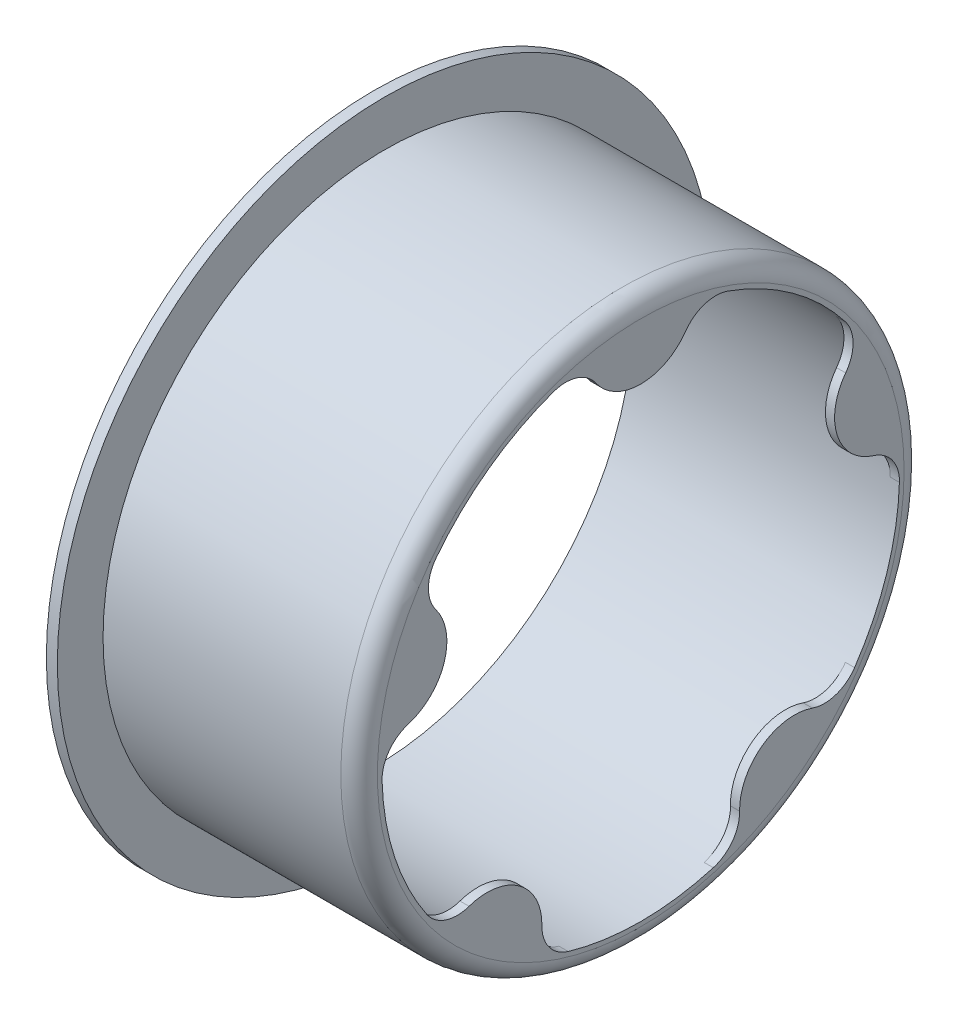
from build123d import *

# Parameters (mm, degrees)
SKETCH_3_R          = 19
CUT_EXTRUDE_1_DEPTH = 0.6
EXTRUDE_1_DEPTH     = 0.5
FILLET_1_R          = 2
FILLET_2_R          = 1


with BuildPart() as part:
    # 草图2 → 旋转1 (revolve)
    with BuildSketch(Plane(origin=(0, 0, 0), x_dir=(1, 0, 0), z_dir=(0, 1, 0)), mode=Mode.PRIVATE) as revolve_1_sk:
        Polygon((-7.6, 14.15), (-7.6, 17.9), (-7, 17.9), (-7, 15.4), (7, 15.4), (7, 17.9), (7.6, 17.9), (7.6, 14.15), align=None)
    revolve(revolve_1_sk.sketch.rotate(Axis((-68.553057404, 0, 0), (1, 0, 0)), 180), axis=Axis((-68.553057404, 0, 0), (1, 0, 0)))

    # 草图3 → 切除-拉伸1 (cut)
    with BuildSketch(Plane(origin=(7.6, 0, 0), x_dir=(0, 0, -1), z_dir=(1, 0, 0))):
        Circle(SKETCH_3_R)
    extrude(amount=-CUT_EXTRUDE_1_DEPTH, mode=Mode.SUBTRACT)

    # 草图4 → 凸台-拉伸1 (add)
    with BuildSketch(Plane(origin=(7, 0, 0), x_dir=(0, 0, -1), z_dir=(1, 0, 0))):
        with BuildLine():
            ThreePointArc((-12.378887951, 7.159129353), (-13.600108183, 4.41894302), (-14.222761377, 1.484270465))
            ThreePointArc((-14.222761377, 1.484270465), (-10.746938634, 3.491892036), (-12.378887951, 7.159129353))
        make_face()
        with BuildLine():
            ThreePointArc((-2.983449874, 13.985314685), (0, 11.3), (2.983449874, 13.985314685))
            ThreePointArc((2.983449874, 13.985314685), (0, 14.3), (-2.983449874, 13.985314685))
        make_face()
        with BuildLine():
            ThreePointArc((12.378887951, 7.159129353), (10.746938634, 3.491892036), (14.222761377, 1.484270465))
            ThreePointArc((14.222761377, 1.484270465), (13.600108183, 4.41894302), (12.378887951, 7.159129353))
        make_face()
        with BuildLine():
            ThreePointArc((10.634023371, -9.560729415), (6.641973351, -9.141892036), (5.80670007, -13.067985089))
            ThreePointArc((5.80670007, -13.067985089), (8.405329108, -11.56894302), (10.634023371, -9.560729415))
        make_face()
        with BuildLine():
            ThreePointArc((-5.80670007, -13.067985089), (-6.641973351, -9.141892036), (-10.634023371, -9.560729415))
            ThreePointArc((-10.634023371, -9.560729415), (-8.405329108, -11.56894302), (-5.80670007, -13.067985089))
        make_face()
    extrude(amount=-EXTRUDE_1_DEPTH)

    # 圆角1
    # the kernel refuses this fillet: 2 mm, written as the material it adds along each edge
    with BuildSketch(Plane(origin=(7, 13.836101399, -2.963916005), x_dir=(0, -0.2740436561087124, -0.9617172529109426), z_dir=(-1, 0, 0)), Plane(origin=(7, 1.456738837, -14.074814811), x_dir=(0, -0.9993316071526622, -0.03655597004153086), z_dir=(-1, 0, 0)), Plane(origin=(7, -12.935787284, -5.734797933), x_dir=(0, -0.3435772431436893, 0.9391244209335534), z_dir=(-1, 0, 0)), Plane(origin=(7, -9.45149505, 10.53051477), x_dir=(0, 0.7869891931288754, 0.6169667818435298), z_dir=(-1, 0, 0)), Plane(origin=(7, 7.094442099, 12.24301398), x_dir=(0, 0.8299633132761892, -0.5578179798246109), z_dir=(-1, 0, 0))) as fillet_1_piece_1:
        with BuildLine():
            CenterArc((1.749454913, 1.995570291), FILLET_1_R, 199.01971257, 74.794373043)
            ThreePointArc((-0.141358103, 1.34378341), (0.005960171, 0.6799537), (0, 0))
            ThreePointArc((0, 0), (0.941246655, -0.031340193), (1.88249331, 0))
        make_face()
    extrude(amount=0.5)
    with BuildSketch(Plane(origin=(7, 13.836101399, 2.963916005), x_dir=(0, -0.2740436561087127, 0.9617172529109423), z_dir=(-1, 0, 0)), Plane(origin=(7, 7.094442099, -12.24301398), x_dir=(0, 0.8299633132761899, 0.5578179798246101), z_dir=(-1, 0, 0)), Plane(origin=(7, -9.45149505, -10.53051477), x_dir=(0, 0.7869891931288755, -0.6169667818435297), z_dir=(-1, 0, 0)), Plane(origin=(7, -12.935787284, 5.734797933), x_dir=(0, -0.34357724314368965, -0.9391244209335534), z_dir=(-1, 0, 0)), Plane(origin=(7, 1.456738837, 14.074814811), x_dir=(0, -0.9993316071526621, 0.03655597004153149), z_dir=(-1, 0, 0))) as fillet_1_piece_2:
        with BuildLine():
            CenterArc((1.749454913, -1.995570291), FILLET_1_R, 86.185914387, 74.794373043)
            ThreePointArc((-0.141358103, -1.34378341), (0.005960171, -0.6799537), (0, 0))
            ThreePointArc((0, 0), (0.941246655, 0.031340193), (1.88249331, 0))
        make_face()
    extrude(amount=0.5)

    # 圆角2
    fillet_2_edges = [part.edges().sort_by_distance(p)[0] for p in [
        (7, 0, -15.4),
    ]]
    fillet(fillet_2_edges, radius=FILLET_2_R)


solid = part.part
